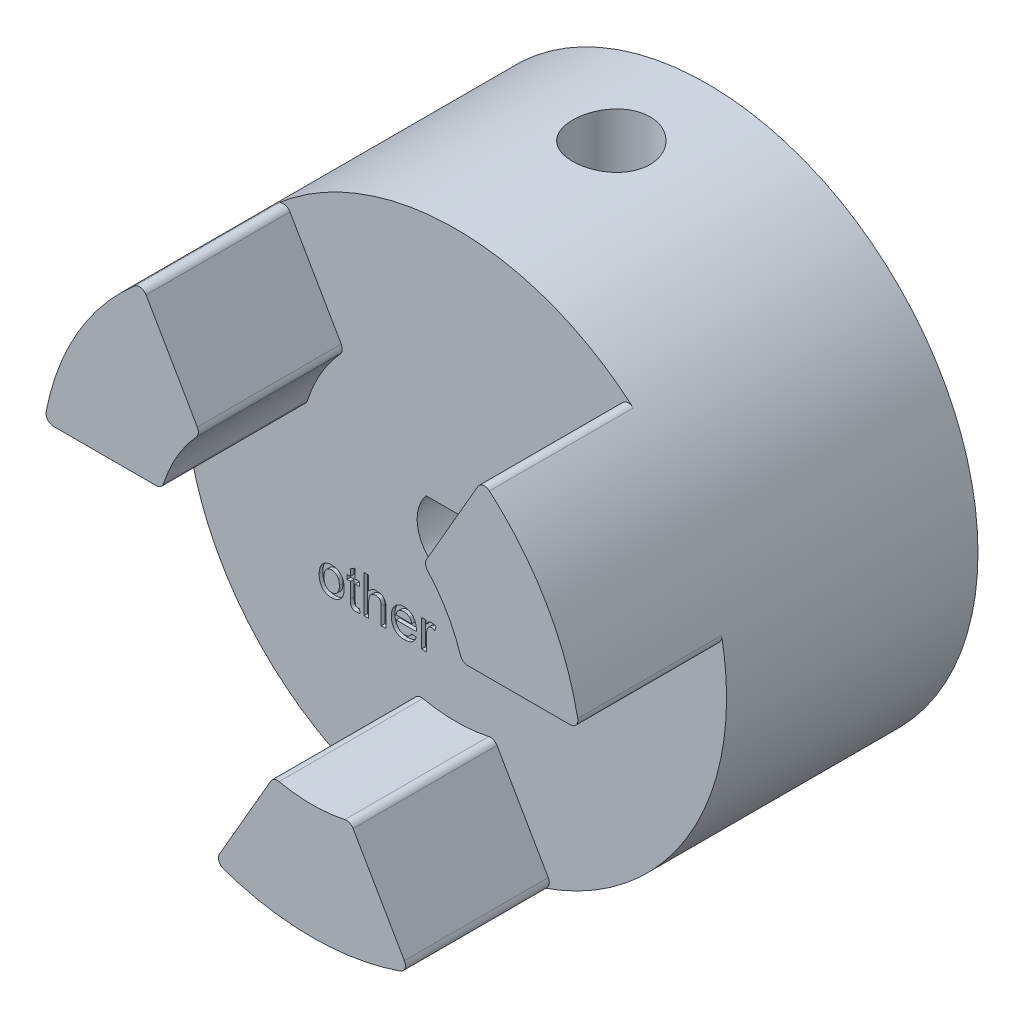
from build123d import *

# Parameters (mm, degrees)
BOSS_EXTRUDE1_START      = -6.35
SKETCH1_R                = 22.225
BOSS_EXTRUDE1_DEPTH      = 20.6375
BOSS_EXTRUDE2_DEPTH      = 11.811
FILLET1_R                = 0.629238567
CIRPATTERN1_COUNT        = 3
FILLET1_OF_CIRPATTERN1_R = 0.629238567
SKETCH5_R                = 3.175
CUT_EXTRUDE2_DEPTH       = 42.427363013
CUT_EXTRUDE9_DEPTH       = 0.3
CUT_EXTRUDE10_DEPTH      = 32


with BuildPart() as part:
    # Sketch1 → Boss-Extrude1 (new body)
    with BuildSketch(Plane.XY.offset(BOSS_EXTRUDE1_START)):
        Circle(SKETCH1_R)
    extrude(amount=-BOSS_EXTRUDE1_DEPTH)

    # Sketch2 → Boss-Extrude2 (add)
    with BuildSketch(Plane.XY.offset(-6.35)):
        with BuildLine():
            Line((-7.961850314, -20.749929267), (-3.146192834, -12.40896584))
            ThreePointArc((-3.146192834, -12.40896584), (0, -12.8016), (3.146192834, -12.40896584))
            Line((3.146192834, -12.40896584), (7.961850314, -20.749929267))
            ThreePointArc((7.961850314, -20.749929267), (0, -22.225), (-7.961850314, -20.749929267))
        make_face()
    boss_extrude2 = extrude(amount=BOSS_EXTRUDE2_DEPTH)

    # Fillet1
    # the kernel refuses this fillet: 0.629238567 mm, written as the material it takes off along each edge
    with BuildSketch(Plane(origin=(-7.961850314, -20.749929267, -6.35), x_dir=(0.9396225267822842, -0.3422126636512382, 0), z_dir=(0, 0, 1))) as fillet1_piece_1:
        with BuildLine():
            CenterArc((0.74972511, 0.629146467), FILLET1_R, 170.011738959, 100.968576742)
            Line((0.130023717, 0.738285633), (0, 0))
            ThreePointArc((0, 0), (0.380245345, -0.003253028), (0.760490691, 0))
        make_face()
    extrude(amount=13.712226726, mode=Mode.SUBTRACT)
    with BuildSketch(Plane(origin=(7.961850314, -20.749929267, -6.35), x_dir=(-0.9396225267822845, -0.34221266365123754, 0), z_dir=(0, 0, 1))) as fillet1_piece_2:
        with BuildLine():
            CenterArc((0.74972511, -0.629146467), FILLET1_R, 89.019684298, 100.968576742)
            Line((0.130023717, -0.738285633), (0, 0))
            ThreePointArc((0, 0), (0.380245345, 0.003253028), (0.760490691, 0))
        make_face()
    extrude(amount=13.712226726, mode=Mode.SUBTRACT)
    with BuildSketch(Plane(origin=(3.146192834, -12.40896584, -6.35), x_dir=(0.499999999999995, -0.8660254037844415, 0), z_dir=(0, 0, 1))) as fillet1_piece_3:
        with BuildLine():
            CenterArc((0.467261956, -0.629238567), FILLET1_R, 90, 72.185239489)
            ThreePointArc((-0.131805005, -0.436728954), (-0.063956994, -0.218951632), (0, 0))
            Line((0, 0), (0.467261956, 0))
        make_face()
    extrude(amount=12.979154889, mode=Mode.SUBTRACT)
    with BuildSketch(Plane(origin=(-3.146192834, -12.40896584, -6.35), x_dir=(0.9735543427841757, -0.22845555726677289, 0), z_dir=(0, 0, 1))) as fillet1_piece_4:
        with BuildLine():
            CenterArc((0.46739644, -0.629138679), FILLET1_R, 91.020921499, 72.185239489)
            Line((-0.135005462, -0.4473335), (0, 0))
            ThreePointArc((0, 0), (0.228092491, -0.00203218), (0.456184982, 0))
        make_face()
    extrude(amount=12.979154889, mode=Mode.SUBTRACT)

    # CirPattern1: Boss-Extrude2 ×3 about axis
    cirpattern1_axis = Axis((0, 0, 0), (0, 0, 1))
    for i in range(1, CIRPATTERN1_COUNT):
        add(boss_extrude2.rotate(cirpattern1_axis, i * 360 / CIRPATTERN1_COUNT))

    # Fillet1 of CirPattern1
    # the kernel refuses this fillet: 0.629238567 mm, written as the material it takes off along each edge
    with BuildSketch(Plane(origin=(21.950891029, 3.4798, -6.35), x_dir=(-0.17344640317242585, 0.9848433099872022, 0), z_dir=(0, 0, 1)), Plane(origin=(-13.989040715, 17.270129267, -6.35), x_dir=(-0.7661761236098587, -0.6426306463359576, 0), z_dir=(0, 0, 1))) as fillet1_of_cirpattern1_piece_1:
        with BuildLine():
            CenterArc((0.74972511, 0.629146467), FILLET1_OF_CIRPATTERN1_R, 170.011738959, 100.968576742)
            Line((0.130023717, 0.738285633), (0, 0))
            ThreePointArc((0, 0), (0.380245345, -0.003253028), (0.760490691, 0))
        make_face()
    extrude(amount=13.712226726, mode=Mode.SUBTRACT)
    with BuildSketch(Plane(origin=(13.989040715, 17.270129267, -6.35), x_dir=(0.7661761236098568, -0.6426306463359598, 0), z_dir=(0, 0, 1)), Plane(origin=(-21.950891029, 3.4798, -6.35), x_dir=(0.17344640317243068, 0.9848433099872013, 0), z_dir=(0, 0, 1))) as fillet1_of_cirpattern1_piece_2:
        with BuildLine():
            CenterArc((0.74972511, -0.629146467), FILLET1_OF_CIRPATTERN1_R, 89.019684298, 100.968576742)
            Line((0.130023717, -0.738285633), (0, 0))
            ThreePointArc((0, 0), (0.380245345, 0.003253028), (0.760490691, 0))
        make_face()
    extrude(amount=13.712226726, mode=Mode.SUBTRACT)
    with BuildSketch(Plane(origin=(9.173383235, 8.92916584, -6.35), x_dir=(0.500000000000006, 0.8660254037844352, 0), z_dir=(0, 0, 1)), Plane(origin=(-12.319576069, 3.4798, -6.35), x_dir=(-1, 0, 0), z_dir=(0, 0, 1))) as fillet1_of_cirpattern1_piece_3:
        with BuildLine():
            CenterArc((0.467261956, -0.629238567), FILLET1_OF_CIRPATTERN1_R, 90, 72.185239489)
            ThreePointArc((-0.131805005, -0.436728954), (-0.063956994, -0.218951632), (0, 0))
            Line((0, 0), (0.467261956, 0))
        make_face()
    extrude(amount=12.979154889, mode=Mode.SUBTRACT)
    with BuildSketch(Plane(origin=(12.319576069, 3.4798, -6.35), x_dir=(-0.288928855163328, 0.957350571449147, 0), z_dir=(0, 0, 1)), Plane(origin=(-9.173383235, 8.92916584, -6.35), x_dir=(-0.684625487620848, -0.728895014182369, 0), z_dir=(0, 0, 1))) as fillet1_of_cirpattern1_piece_4:
        with BuildLine():
            CenterArc((0.46739644, -0.629138679), FILLET1_OF_CIRPATTERN1_R, 91.020921499, 72.185239489)
            Line((-0.135005462, -0.4473335), (0, 0))
            ThreePointArc((0, 0), (0.228092491, -0.00203218), (0.456184982, 0))
        make_face()
    extrude(amount=12.979154889, mode=Mode.SUBTRACT)

    # Sketch5 → Cut-Extrude2 (cut, through all)
    with BuildSketch(Plane(origin=(0, 0, 0), x_dir=(1, 0, 0), z_dir=(0, 1, 0))):
        with Locations(Location((0, 19.1135, 0), (0, 0, 90))):
            Circle(SKETCH5_R)
    extrude(amount=CUT_EXTRUDE2_DEPTH, mode=Mode.SUBTRACT)

    # Sketch20 → Cut-Extrude9 (cut)
    # profile 1 of 5: a face of its own
    with BuildSketch(Plane.XY.offset(-6.35)):
        with BuildLine():
            add(Edge.make_bspline(
                [(-11.219700622, -7.9263054), (-11.218594195, -7.876258497), (-11.216453177, -7.779414086), (-11.201121586, -7.638885388), (-11.174836691, -7.508419379), (-11.137949445, -7.387893521), (-11.090246926, -7.277269842), (-11.031316493, -7.177169007), (-10.962783436, -7.085751991), (-10.90809015, -7.034079022), (-10.880756642, -7.008254947)],
                knots=[0, 0, 0, 0, 1.189940866, 2.302622481, 3.356378305, 4.350088409, 5.294652018, 6.213657312, 7.107257627, 8, 8, 8, 8], degree=3))
            add(Edge.make_bspline(
                [(-10.880756642, -7.008254947), (-10.856849883, -6.988408907), (-10.809472579, -6.949078948), (-10.732144016, -6.899202425), (-10.651636375, -6.856349935), (-10.567238264, -6.820818675), (-10.478682948, -6.793671508), (-10.386246184, -6.774830162), (-10.290046119, -6.762520673), (-10.224516044, -6.761303704), (-10.191138379, -6.760683843)],
                knots=[0, 0, 0, 0, 0.994414631, 1.970684744, 2.940793954, 3.912782355, 4.898970837, 5.902128985, 6.931451948, 8, 8, 8, 8], degree=3))
            add(Edge.make_bspline(
                [(-10.191138379, -6.760683843), (-10.154267801, -6.761724088), (-10.082123679, -6.763759521), (-9.976256059, -6.777032764), (-9.876006685, -6.801699162), (-9.780084728, -6.834026992), (-9.689942672, -6.877109259), (-9.60415676, -6.928472153), (-9.524827561, -6.990719844), (-9.450434675, -7.061079072), (-9.383323657, -7.139763858), (-9.324853797, -7.226387588), (-9.275338186, -7.320201967), (-9.234435564, -7.421295936), (-9.203067506, -7.529740163), (-9.18120317, -7.645302902), (-9.167196717, -7.767704236), (-9.165774183, -7.851767998), (-9.165045674, -7.8948188)],
                knots=[0, 0, 0, 0, 1.026363227, 2.008269884, 2.962742747, 3.895658536, 4.820662428, 5.738204837, 6.673158329, 7.621267452, 8.584296177, 9.545483285, 10.524327568, 11.531652541, 12.575780624, 13.660990097, 14.802144351, 16, 16, 16, 16], degree=3))
            add(Edge.make_bspline(
                [(-9.165045674, -7.8948188), (-9.165320163, -7.92981452), (-9.165853459, -7.997806517), (-9.172299784, -8.09687673), (-9.182041161, -8.190200415), (-9.195299397, -8.277883783), (-9.213158881, -8.359786245), (-9.235429898, -8.435842039), (-9.261257638, -8.506461922), (-9.290941939, -8.571721268), (-9.324812952, -8.632147248), (-9.361712867, -8.689042247), (-9.402569274, -8.742319949), (-9.4473298, -8.791892058), (-9.495390433, -8.838118093), (-9.54707909, -8.881173292), (-9.602491184, -8.920437807), (-9.680722015, -8.968110172), (-9.783976976, -9.018065641), (-9.914754553, -9.060876425), (-10.051190273, -9.086969336), (-10.144102963, -9.090260741), (-10.191138379, -9.091926957)],
                knots=[0, 0, 0, 0, 1.174068422, 2.28105775, 3.329581501, 4.321819531, 5.255045276, 6.14001734, 6.978936381, 7.776151739, 8.542754425, 9.301196708, 10.049767304, 10.792968067, 11.540167917, 12.285482871, 13.048063169, 13.816653646, 15.357768987, 16.884132754, 18.422646949, 20, 20, 20, 20], degree=3))
            add(Edge.make_bspline(
                [(-10.191138379, -9.091926957), (-10.228632591, -9.090910062), (-10.302019269, -9.088919715), (-10.409384208, -9.07533985), (-10.511280089, -9.052070644), (-10.607399543, -9.018160968), (-10.698599244, -8.976535234), (-10.784017372, -8.924571956), (-10.863818979, -8.863403369), (-10.937299297, -8.792634851), (-11.004484887, -8.713843258), (-11.061836313, -8.625336793), (-11.110922125, -8.528940949), (-11.151025144, -8.424239997), (-11.181658256, -8.311230785), (-11.203656601, -8.190210819), (-11.217561686, -8.061013725), (-11.218974617, -7.972028561), (-11.219700622, -7.9263054)],
                knots=[0, 0, 0, 0, 1.022681766, 2.001674804, 2.94671416, 3.868132449, 4.777362857, 5.676573364, 6.589418535, 7.514523194, 8.454681358, 9.407574523, 10.384198733, 11.400667853, 12.460217505, 13.573389442, 14.753137007, 16, 16, 16, 16], degree=3))
        make_face()
        with BuildLine():
            add(Edge.make_bspline(
                [(-10.82457467, -7.925070631), (-10.823904114, -7.958011614), (-10.822607036, -8.0217304), (-10.814865988, -8.114215911), (-10.800724521, -8.200077543), (-10.781050488, -8.279627235), (-10.755816221, -8.352876267), (-10.724888807, -8.419948654), (-10.68860566, -8.480901254), (-10.646179467, -8.534740401), (-10.600005311, -8.582328229), (-10.55020264, -8.623376503), (-10.49746406, -8.658231601), (-10.44169994, -8.686651441), (-10.383162805, -8.709105669), (-10.321725294, -8.725273121), (-10.257278457, -8.734556513), (-10.21339363, -8.735722364), (-10.191138379, -8.7363136)],
                knots=[0, 0, 0, 0, 1.36128903, 2.633184439, 3.831299874, 4.953299848, 6.015607462, 7.027679361, 8.000438392, 8.93945591, 9.853536715, 10.73548639, 11.60109037, 12.460616037, 13.316600729, 14.187036799, 15.080594522, 16, 16, 16, 16], degree=3))
            add(Edge.make_bspline(
                [(-10.191138379, -8.7363136), (-10.169074374, -8.735809387), (-10.125539886, -8.734814525), (-10.061932004, -8.724281853), (-10.000714965, -8.709171678), (-9.94239455, -8.686875736), (-9.887456001, -8.657465364), (-9.834834711, -8.622676797), (-9.785597295, -8.581027958), (-9.738894874, -8.53353131), (-9.697074896, -8.478897753), (-9.659563533, -8.418186548), (-9.628743457, -8.350024802), (-9.603827497, -8.275456285), (-9.583935583, -8.194322234), (-9.56985997, -8.106591668), (-9.562164127, -8.012053855), (-9.560848981, -7.946898214), (-9.560171626, -7.913340329)],
                knots=[0, 0, 0, 0, 0.904535546, 1.784739026, 2.638791991, 3.488785886, 4.338695884, 5.191202824, 6.07237792, 6.980061329, 7.919174549, 8.889507933, 9.902165842, 10.981000531, 12.111539881, 13.326270405, 14.622917219, 16, 16, 16, 16], degree=3))
            add(Edge.make_bspline(
                [(-9.560171626, -7.913340329), (-9.56085469, -7.881635147), (-9.56218314, -7.819973731), (-9.569837539, -7.7303446), (-9.584160767, -7.646794606), (-9.603452164, -7.569088253), (-9.629895888, -7.49786541), (-9.660280651, -7.431775833), (-9.69779209, -7.372130307), (-9.740348384, -7.318592401), (-9.786796793, -7.270947148), (-9.83615833, -7.229133548), (-9.888947186, -7.194794816), (-9.943891611, -7.165601179), (-10.001881469, -7.143788051), (-10.062368742, -7.127287877), (-10.125819475, -7.118035278), (-10.169089607, -7.116883898), (-10.191138379, -7.116297199)],
                knots=[0, 0, 0, 0, 1.329905342, 2.586449315, 3.768451236, 4.882143757, 5.938857988, 6.950440627, 7.927559667, 8.885972819, 9.813736587, 10.714405609, 11.592966897, 12.450023853, 13.318821862, 14.185602452, 15.075453733, 16, 16, 16, 16], degree=3))
            add(Edge.make_bspline(
                [(-10.191138379, -7.116297199), (-10.213391739, -7.116893344), (-10.257272838, -7.118068875), (-10.3217468, -7.127281839), (-10.38301462, -7.14368842), (-10.441850042, -7.165163675), (-10.497408269, -7.193856687), (-10.550452275, -7.228520432), (-10.599570171, -7.270346355), (-10.646442829, -7.317198241), (-10.688382281, -7.371043471), (-10.72491238, -7.431383513), (-10.755939252, -7.498036754), (-10.781032434, -7.571137903), (-10.800729749, -7.650679195), (-10.814864798, -7.736543288), (-10.822588803, -7.828822936), (-10.823899252, -7.892335571), (-10.82457467, -7.925070631)],
                knots=[0, 0, 0, 0, 0.920966903, 1.816042154, 2.687956485, 3.542385364, 4.403370762, 5.270444796, 6.159337503, 7.068888003, 8.009500254, 8.976623456, 9.982690403, 11.046802133, 12.170707598, 13.370857791, 14.644913259, 16, 16, 16, 16], degree=3))
        make_face(mode=Mode.SUBTRACT)
    # profile 2 of 5: a face of its own
    with BuildSketch(Plane.XY.offset(-6.35)):
        with BuildLine():
            Line((-7.900642629, -8.726435451), (-7.861130034, -9.05797082))
            add(Edge.make_bspline(
                [(-7.861130034, -9.05797082), (-7.886394615, -9.063190258), (-7.935294735, -9.073292589), (-8.007066967, -9.083383646), (-8.074578181, -9.091093007), (-8.118353107, -9.091654707), (-8.139570353, -9.091926957)],
                knots=[0, 0, 0, 0, 1.101333134, 2.13165308, 3.094431941, 4, 4, 4, 4], degree=3))
            add(Edge.make_bspline(
                [(-8.139570353, -9.091926957), (-8.171089432, -9.091067062), (-8.230664204, -9.089441759), (-8.314761725, -9.078297188), (-8.387709454, -9.058070441), (-8.450113395, -9.030251852), (-8.50192929, -8.995074813), (-8.545524755, -8.95492771), (-8.580817189, -8.909729167), (-8.604203138, -8.867187186), (-8.617969849, -8.827533742), (-8.62706754, -8.790557046), (-8.634019389, -8.746092615), (-8.640962507, -8.694888946), (-8.645825258, -8.636164578), (-8.648361276, -8.570454771), (-8.651324347, -8.497410181), (-8.651362134, -8.446352583), (-8.651381937, -8.419595455)],
                knots=[0, 0, 0, 0, 1.515965932, 2.865354161, 4.068592833, 5.144966063, 6.135994557, 7.067504024, 7.984224584, 8.88319335, 9.387210378, 9.999362939, 10.71208193, 11.550605788, 12.484373718, 13.544606854, 14.713232298, 16, 16, 16, 16], degree=3))
            Line((-8.651381937, -8.419595455), (-8.651381937, -7.155809794))
            Line((-8.651381937, -7.155809794), (-8.927970103, -7.155809794))
            Line((-8.927970103, -7.155809794), (-8.927970103, -6.800196438))
            Line((-8.927970103, -6.800196438), (-8.651381937, -6.800196438))
            Line((-8.651381937, -6.800196438), (-8.651381937, -6.25195918))
            Line((-8.651381937, -6.25195918), (-8.256255986, -6.027231295))
            Line((-8.256255986, -6.027231295), (-8.256255986, -6.800196438))
            Line((-8.256255986, -6.800196438), (-7.900642629, -6.800196438))
            Line((-7.900642629, -6.800196438), (-7.900642629, -7.155809794))
            Line((-7.900642629, -7.155809794), (-8.256255986, -7.155809794))
            Line((-8.256255986, -7.155809794), (-8.256255986, -8.433795294))
            add(Edge.make_bspline(
                [(-8.256255986, -8.433795294), (-8.256104496, -8.457881455), (-8.255831068, -8.50135544), (-8.252061547, -8.559453668), (-8.247405205, -8.603572764), (-8.237603966, -8.643519944), (-8.214691716, -8.679749686), (-8.184123361, -8.707241984), (-8.153079414, -8.722806445), (-8.124295944, -8.730301282), (-8.091381754, -8.735295162), (-8.067975688, -8.73596147), (-8.055606088, -8.7363136)],
                knots=[0, 0, 0, 0, 1.693748017, 3.05710712, 4.093010578, 4.8128101, 5.929870973, 7.047775512, 7.662723095, 8.354621928, 9.130453249, 10, 10, 10, 10], degree=3))
            add(Edge.make_bspline(
                [(-8.055606088, -8.7363136), (-8.0451084, -8.736176744), (-8.022452974, -8.735881388), (-7.986019273, -8.733854653), (-7.94484871, -8.730811552), (-7.915865696, -8.727942431), (-7.900642629, -8.726435451)],
                knots=[0, 0, 0, 0, 0.810958033, 1.750156657, 2.818290096, 4, 4, 4, 4], degree=3))
        make_face()
    # profile 3 of 5: a face of its own
    with BuildSketch(Plane.XY.offset(-6.35)):
        with BuildLine():
            Line((-7.545029273, -9.052414361), (-7.545029273, -5.97043194))
            Line((-7.545029273, -5.97043194), (-7.149903321, -5.97043194))
            Line((-7.149903321, -5.97043194), (-7.149903321, -7.095923517))
            add(Edge.make_bspline(
                [(-7.149903321, -7.095923517), (-7.128022489, -7.069286604), (-7.085056469, -7.016981366), (-7.012569289, -6.948648107), (-6.936056193, -6.890151376), (-6.854621472, -6.843436199), (-6.76964687, -6.805471396), (-6.679778159, -6.780071884), (-6.586056727, -6.763032026), (-6.52189568, -6.761474871), (-6.489302121, -6.760683843)],
                knots=[0, 0, 0, 0, 1.075179344, 2.11126231, 3.101893549, 4.07484835, 5.035680757, 5.999322527, 6.983663715, 8, 8, 8, 8], degree=3))
            add(Edge.make_bspline(
                [(-6.489302121, -6.760683843), (-6.449703254, -6.761756705), (-6.372925579, -6.763836863), (-6.261924015, -6.783150786), (-6.158390932, -6.812745941), (-6.064088663, -6.856219332), (-5.979680377, -6.909504423), (-5.907392453, -6.973377765), (-5.848019404, -7.046702084), (-5.810217766, -7.116097878), (-5.78547922, -7.176411905), (-5.770521617, -7.227473396), (-5.756905604, -7.282840427), (-5.745582042, -7.343189542), (-5.738141523, -7.408627976), (-5.731795035, -7.478806117), (-5.728106216, -7.553983595), (-5.727673758, -7.605673256), (-5.727449896, -7.632430473)],
                knots=[0, 0, 0, 0, 1.423572297, 2.760143949, 4.041704725, 5.287516156, 6.482931736, 7.621116371, 8.742804, 9.859691372, 10.450931907, 11.085684043, 11.77170108, 12.502189623, 13.292936877, 14.140280139, 15.037313705, 16, 16, 16, 16], degree=3))
            Line((-5.727449896, -7.632430473), (-5.727449896, -9.052414361))
            Line((-5.727449896, -9.052414361), (-6.122575847, -9.052414361))
            Line((-6.122575847, -9.052414361), (-6.122575847, -7.652804155))
            add(Edge.make_bspline(
                [(-6.122575847, -7.652804155), (-6.122905173, -7.63015455), (-6.123540947, -7.586428823), (-6.129125482, -7.523307596), (-6.138276345, -7.464887635), (-6.151128958, -7.41116265), (-6.167504046, -7.361899645), (-6.188737022, -7.318026095), (-6.212901165, -7.278516322), (-6.240841805, -7.243577119), (-6.272511895, -7.213512767), (-6.306767715, -7.186881945), (-6.344715139, -7.165653551), (-6.385321059, -7.147380109), (-6.429187049, -7.133174089), (-6.476224794, -7.123681674), (-6.526158353, -7.117064607), (-6.560483688, -7.116558497), (-6.57820546, -7.116297199)],
                knots=[0, 0, 0, 0, 1.348466509, 2.603254179, 3.769725567, 4.866462031, 5.889525116, 6.854190675, 7.762162134, 8.642507241, 9.509185433, 10.357210019, 11.219023099, 12.091228191, 13.005791182, 13.957527608, 14.945495211, 16, 16, 16, 16], degree=3))
            add(Edge.make_bspline(
                [(-6.57820546, -7.116297199), (-6.605041764, -7.11737943), (-6.658171557, -7.119522002), (-6.736734082, -7.136386717), (-6.8127219, -7.163571012), (-6.885180144, -7.201151473), (-6.951762811, -7.247280767), (-7.00865762, -7.302863614), (-7.054883544, -7.366205972), (-7.091796608, -7.437912148), (-7.11790111, -7.520855505), (-7.136650895, -7.616281107), (-7.148241348, -7.725579961), (-7.149329069, -7.803209477), (-7.149903321, -7.844193288)],
                knots=[0, 0, 0, 0, 0.917620555, 1.816680451, 2.736567805, 3.671956967, 4.601896568, 5.4982222, 6.379906244, 7.274321234, 8.245216896, 9.344499276, 10.598052048, 12, 12, 12, 12], degree=3))
            Line((-7.149903321, -7.844193288), (-7.149903321, -9.052414361))
            Line((-7.149903321, -9.052414361), (-7.545029273, -9.052414361))
        make_face()
    # profile 4 of 5: a face of its own
    with BuildSketch(Plane.XY.offset(-6.35)):
        with BuildLine():
            Line((-3.637604043, -8.380700244), (-3.250504087, -8.420212839))
            add(Edge.make_bspline(
                [(-3.250504087, -8.420212839), (-3.25844117, -8.44632372), (-3.274054966, -8.497688929), (-3.305735439, -8.57054033), (-3.340548, -8.639752618), (-3.381678333, -8.703817579), (-3.426808303, -8.76409871), (-3.476832093, -8.820115184), (-3.53284316, -8.870453621), (-3.592759558, -8.917216201), (-3.657578227, -8.958312629), (-3.726615888, -8.994595876), (-3.800125333, -9.024540387), (-3.877896764, -9.049485841), (-3.960107952, -9.068511622), (-4.046606373, -9.0816555), (-4.137277903, -9.090967436), (-4.199192899, -9.091601924), (-4.230910354, -9.091926957)],
                knots=[0, 0, 0, 0, 1.017198368, 2.001028156, 2.958938375, 3.904526299, 4.836491671, 5.766019286, 6.700699831, 7.641977538, 8.598163567, 9.559604839, 10.547559217, 11.555094156, 12.60347703, 13.691418688, 14.817373327, 16, 16, 16, 16], degree=3))
            add(Edge.make_bspline(
                [(-4.230910354, -9.091926957), (-4.270674658, -9.090992514), (-4.348202718, -9.089170639), (-4.461423007, -9.074555097), (-4.568368892, -9.051434937), (-4.669273279, -9.01867773), (-4.763489532, -8.975989091), (-4.851256906, -8.923486645), (-4.933121323, -8.862383374), (-5.00790435, -8.791603201), (-5.075565044, -8.712717628), (-5.133350043, -8.625003783), (-5.183465985, -8.530563786), (-5.223325031, -8.427863567), (-5.254829866, -8.317931395), (-5.276689235, -8.200299427), (-5.290674856, -8.075434365), (-5.292086868, -7.989523689), (-5.292811349, -7.945444313)],
                knots=[0, 0, 0, 0, 1.077616366, 2.10101772, 3.089143248, 4.040031729, 4.971276009, 5.886882173, 6.807369977, 7.734796568, 8.672701003, 9.618074947, 10.576315496, 11.565652878, 12.598619221, 13.67195277, 14.805516698, 16, 16, 16, 16], degree=3))
            add(Edge.make_bspline(
                [(-5.292811349, -7.945444313), (-5.292079847, -7.89972299), (-5.290659494, -7.81094612), (-5.276853187, -7.681687166), (-5.254020408, -7.560325608), (-5.223036985, -7.446421138), (-5.1819819, -7.340524002), (-5.131887253, -7.242672807), (-5.073062793, -7.152337756), (-5.004940296, -7.070841646), (-4.929562291, -6.998371725), (-4.849323721, -6.933929985), (-4.762540599, -6.880748357), (-4.670986831, -6.836593304), (-4.573780014, -6.802668957), (-4.471518954, -6.777685344), (-4.363425013, -6.763587776), (-4.289601551, -6.761665506), (-4.251901421, -6.760683843)],
                knots=[0, 0, 0, 0, 1.232307979, 2.392766439, 3.499416159, 4.558769794, 5.570548426, 6.555643267, 7.517416609, 8.470735273, 9.412423306, 10.33263532, 11.239503873, 12.150233765, 13.067967044, 14.009932887, 14.983713455, 16, 16, 16, 16], degree=3))
            add(Edge.make_bspline(
                [(-4.251901421, -6.760683843), (-4.215425111, -6.761621837), (-4.14403991, -6.763457518), (-4.039458179, -6.77819088), (-3.939804434, -6.801214244), (-3.845287899, -6.83465442), (-3.756384266, -6.878550223), (-3.672133374, -6.930940876), (-3.593123768, -6.993342655), (-3.519862175, -7.06490529), (-3.453109958, -7.144825296), (-3.395368288, -7.23341262), (-3.346475459, -7.329421588), (-3.306840503, -7.4335862), (-3.27633097, -7.545306067), (-3.254227625, -7.664654335), (-3.240288209, -7.791590423), (-3.238880206, -7.878935049), (-3.238156401, -7.923835862)],
                knots=[0, 0, 0, 0, 1.005323219, 1.967446859, 2.906060863, 3.821317632, 4.724696067, 5.63467896, 6.55185077, 7.494776645, 8.453732942, 9.416859909, 10.403972786, 11.418730779, 12.484189468, 13.592581733, 14.76243057, 16, 16, 16, 16], degree=3))
            add(Edge.make_bspline(
                [(-3.238156401, -7.923835862), (-3.238344427, -7.937830222), (-3.238797929, -7.971583476), (-3.239561541, -8.005331219), (-3.240008554, -8.025086887)],
                knots=[0, 0, 0, 0, 0.829215456, 2, 2, 2, 2], degree=3))
            Line((-3.240008554, -8.025086887), (-4.897685398, -8.025086887))
            add(Edge.make_bspline(
                [(-4.897685398, -8.025086887), (-4.89539792, -8.05291394), (-4.890922699, -8.107354779), (-4.877872302, -8.186175071), (-4.860260476, -8.260249985), (-4.836552882, -8.328927284), (-4.808546319, -8.392976135), (-4.773934921, -8.451343029), (-4.735374881, -8.505324307), (-4.691070355, -8.553603873), (-4.643257178, -8.596548149), (-4.592091343, -8.634219954), (-4.537663588, -8.665465737), (-4.480761298, -8.691733385), (-4.420852734, -8.711499823), (-4.358211298, -8.72564527), (-4.292487382, -8.734495102), (-4.247607762, -8.735699714), (-4.224736511, -8.7363136)],
                knots=[0, 0, 0, 0, 1.224729154, 2.396059788, 3.502114335, 4.561587772, 5.580251543, 6.563724943, 7.533714888, 8.486186356, 9.43260269, 10.350144711, 11.268619442, 12.181885516, 13.095687177, 14.031096784, 14.996620783, 16, 16, 16, 16], degree=3))
            add(Edge.make_bspline(
                [(-4.224736511, -8.7363136), (-4.191342862, -8.735195526), (-4.126650927, -8.733029535), (-4.033306326, -8.717833546), (-3.947741326, -8.691039969), (-3.869354614, -8.653846975), (-3.798276268, -8.604544644), (-3.736254446, -8.541438571), (-3.681112449, -8.466646547), (-3.652432327, -8.409991968), (-3.637604043, -8.380700244)],
                knots=[0, 0, 0, 0, 1.096312125, 2.123833578, 3.094060441, 4.030938787, 4.962563683, 5.918139224, 6.923629937, 8, 8, 8, 8], degree=3))
        make_face()
        with BuildLine():
            Line((-4.897685398, -7.669473531), (-3.633282353, -7.669473531))
            add(Edge.make_bspline(
                [(-3.633282353, -7.669473531), (-3.635769568, -7.649896395), (-3.640632619, -7.611618812), (-3.650868559, -7.556255071), (-3.664520048, -7.504673101), (-3.680961174, -7.457066645), (-3.701010011, -7.413344565), (-3.723661931, -7.373439773), (-3.748972608, -7.336926114), (-3.768644099, -7.315705892), (-3.778367663, -7.305216795)],
                knots=[0, 0, 0, 0, 1.185316253, 2.317552585, 3.379013743, 4.387694847, 5.339152611, 6.263729899, 7.141766409, 8, 8, 8, 8], degree=3))
            add(Edge.make_bspline(
                [(-3.778367663, -7.305216795), (-3.793903703, -7.290053126), (-3.824590036, -7.260102288), (-3.87575246, -7.221493741), (-3.930736956, -7.189476137), (-3.988474559, -7.161850832), (-4.050256704, -7.141837023), (-4.114846423, -7.126717751), (-4.183142821, -7.118152944), (-4.229858537, -7.116925193), (-4.253753573, -7.116297199)],
                knots=[0, 0, 0, 0, 0.989486767, 1.954405495, 2.91383024, 3.888017634, 4.867526279, 5.869356945, 6.910178459, 8, 8, 8, 8], degree=3))
            add(Edge.make_bspline(
                [(-4.253753573, -7.116297199), (-4.275380306, -7.116799418), (-4.317713145, -7.117782476), (-4.380078732, -7.12470025), (-4.439852173, -7.136168145), (-4.49692751, -7.153183205), (-4.551513221, -7.173862995), (-4.603225497, -7.20029815), (-4.652426315, -7.231014881), (-4.698919708, -7.266150646), (-4.740979109, -7.305526742), (-4.779442979, -7.347471045), (-4.81128721, -7.393829119), (-4.839521929, -7.442440983), (-4.861629905, -7.494823745), (-4.879034279, -7.550205743), (-4.891423476, -7.608739608), (-4.895579492, -7.649048504), (-4.897685398, -7.669473531)],
                knots=[0, 0, 0, 0, 1.10270868, 2.158476208, 3.195774995, 4.201977093, 5.192014471, 6.168217026, 7.158254405, 8.146844603, 9.134487423, 10.093158795, 11.042305272, 11.996428104, 12.955501471, 13.934632866, 14.95345241, 16, 16, 16, 16], degree=3))
        make_face(mode=Mode.SUBTRACT)
    # profile 5 of 5: a face of its own
    with BuildSketch(Plane.XY.offset(-6.35)):
        with BuildLine():
            Line((-2.803517855, -9.052414361), (-2.803517855, -6.800196438))
            Line((-2.803517855, -6.800196438), (-2.447904498, -6.800196438))
            Line((-2.447904498, -6.800196438), (-2.447904498, -7.114445046))
            add(Edge.make_bspline(
                [(-2.447904498, -7.114445046), (-2.428012753, -7.081206961), (-2.391160624, -7.019628947), (-2.333037985, -6.938484932), (-2.27773494, -6.874932294), (-2.221907398, -6.829648544), (-2.166039296, -6.798308533), (-2.108991451, -6.776732629), (-2.049305959, -6.763026831), (-2.008606806, -6.761472579), (-1.987953195, -6.760683843)],
                knots=[0, 0, 0, 0, 1.517336028, 2.811068648, 3.907416798, 4.807929446, 5.613162482, 6.406966847, 7.191583018, 8, 8, 8, 8], degree=3))
            add(Edge.make_bspline(
                [(-1.987953195, -6.760683843), (-1.957385073, -6.762048048), (-1.895427141, -6.764813131), (-1.802593419, -6.786033949), (-1.708661329, -6.818207649), (-1.648833766, -6.849964243), (-1.61814, -6.866256558)],
                knots=[0, 0, 0, 0, 0.943117096, 1.911585642, 2.928565726, 4, 4, 4, 4], degree=3))
            Line((-1.61814, -6.866256558), (-1.74161686, -7.208904844))
            add(Edge.make_bspline(
                [(-1.74161686, -7.208904844), (-1.763053803, -7.194651785), (-1.804397129, -7.167163312), (-1.870689217, -7.138050079), (-1.936927934, -7.119468612), (-1.981458134, -7.117343666), (-2.003387803, -7.116297199)],
                knots=[0, 0, 0, 0, 1.093324321, 2.108587182, 3.068540977, 4, 4, 4, 4], degree=3))
            add(Edge.make_bspline(
                [(-2.003387803, -7.116297199), (-2.022410293, -7.117263572), (-2.059969494, -7.11917164), (-2.114848162, -7.133991995), (-2.166479413, -7.158486063), (-2.214823445, -7.191899931), (-2.257820361, -7.2341353), (-2.295558056, -7.283530126), (-2.326053772, -7.34095204), (-2.340057572, -7.382971606), (-2.347270857, -7.404615667)],
                knots=[0, 0, 0, 0, 0.946345552, 1.868524143, 2.808299705, 3.780481321, 4.780563855, 5.797153696, 6.865325266, 8, 8, 8, 8], degree=3))
            add(Edge.make_bspline(
                [(-2.347270857, -7.404615667), (-2.356691134, -7.439678906), (-2.375817034, -7.510867475), (-2.394181014, -7.621639265), (-2.406597274, -7.737100825), (-2.407785272, -7.815758459), (-2.408391903, -7.855923589)],
                knots=[0, 0, 0, 0, 0.953038166, 1.934944501, 2.945515915, 4, 4, 4, 4], degree=3))
            Line((-2.408391903, -7.855923589), (-2.408391903, -9.052414361))
            Line((-2.408391903, -9.052414361), (-2.803517855, -9.052414361))
        make_face()
    extrude(amount=-CUT_EXTRUDE9_DEPTH, mode=Mode.SUBTRACT)

    # Sketch22 → Cut-Extrude10 (cut)
    with BuildSketch(Plane.XY.offset(-6.35)):
        with BuildLine():
            Line((-2.439590334, 2.032), (2.439590334, 2.032))
            ThreePointArc((2.439590334, 2.032), (0, -3.175), (-2.439590334, 2.032))
        make_face()
    extrude(amount=-CUT_EXTRUDE10_DEPTH, mode=Mode.SUBTRACT)


solid = part.part
